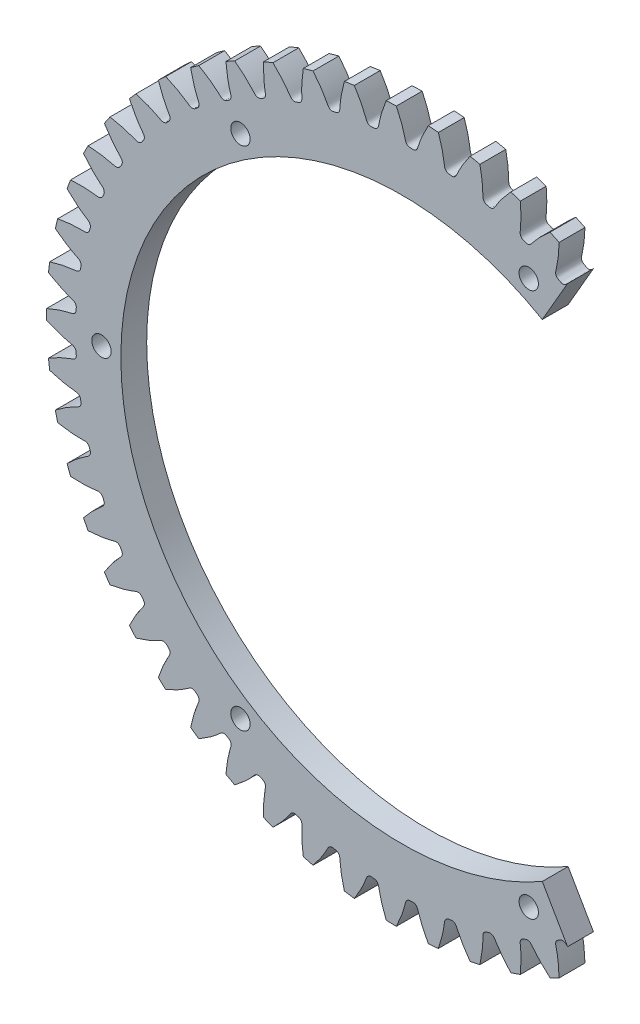
from build123d import *

# Parameters (mm, degrees)
SKETCH_339_W               = 4
SKETCH_339_H               = 54.999999174
CUT_EXTRUDE_594_DEPTH      = 2
PATTERN_CIRCULAR_646_COUNT = 53
CUT_EXTRUDE_START          = -10
SKETCH_1_R                 = 1.5
CUT_EXTRUDE_1_DEPTH        = 10


with BuildPart() as part:
    # Sketch 339 → Revolve 365 (revolve)
    with BuildSketch(Plane(origin=(0, 0, 0), x_dir=(0, 0, -1), z_dir=(1, 0, 0))):
        with Locations((0, 27.499999587)):
            Rectangle(SKETCH_339_W, SKETCH_339_H)
    revolve(axis=Axis((0, 0, 0), (0, 0, -1)))

    # Sketch 408 → Cut-Extrude 594 (cut, symmetric)
    with BuildSketch(Plane.XY):
        with BuildLine():
            ThreePointArc((55.041790784, 2.532030032), (55.099999172, 0), (55.041790784, -2.532030032))
            add(Edge.make_bspline(
                [(55.041790784, -2.532030032), (54.97592231, -2.497064374), (54.888177031, -2.451017899), (54.778505022, -2.394362073), (54.713498983, -2.361043168), (54.648840279, -2.32816281), (54.584531045, -2.295718436), (54.520573402, -2.263707474), (54.45696946, -2.232127342), (54.393721314, -2.200975452), (54.330831048, -2.170249202), (54.268300731, -2.139945986), (54.206132421, -2.110063185), (54.144328161, -2.080598175), (54.082889983, -2.05154832), (54.021819904, -2.022910978), (53.961119928, -1.994683496), (53.900792048, -1.966863213), (53.84083824, -1.939447462), (53.781260471, -1.912433564), (53.722060692, -1.885818832), (53.66324084, -1.859600574), (53.604802841, -1.833776086), (53.546748606, -1.808342658), (53.489080034, -1.78329757), (53.431799009, -1.758638096), (53.374907401, -1.7343615), (53.318407069, -1.710465038), (53.262299856, -1.686945961), (53.206587593, -1.663801508), (53.151272097, -1.641028913), (53.09635517, -1.618625402), (53.041838602, -1.596588191), (52.987724169, -1.574914491), (52.934013633, -1.553601504), (52.880708742, -1.532646426), (52.827811229, -1.512046443), (52.775322817, -1.491798735), (52.72324521, -1.471900476), (52.671580103, -1.45234883), (52.620329173, -1.433140956), (52.569494086, -1.414274004), (52.519076493, -1.395745118), (52.46907803, -1.377551435), (52.419500319, -1.359690085), (52.370344971, -1.342158191), (52.32161358, -1.324952868), (52.273307725, -1.308071226), (52.225428973, -1.291510366), (52.177978877, -1.275267385), (52.130958975, -1.259339373), (52.084370789, -1.24372341), (52.03821583, -1.228416573), (51.992495593, -1.213415933), (51.947211559, -1.198718551), (51.902365194, -1.184321485), (51.85795795, -1.170221786), (51.813991265, -1.156416497), (51.770466562, -1.142902657), (51.727385251, -1.129677298), (51.684748726, -1.116737446), (51.642558366, -1.104080122), (51.600815538, -1.09170234), (51.559521592, -1.079601107), (51.518677867, -1.06777343), (51.478285671, -1.056216293), (51.438346364, -1.044926734), (51.398861049, -1.033901567), (51.359831692, -1.023138403), (51.321257039, -1.012631908), (51.223739906, -0.98641783), (51.121213809, -0.959873857), (51.017889312, -0.91993613), (50.967425059, -0.898009557), (50.916533588, -0.872864773), (50.864684791, -0.843562747), (50.81136359, -0.808712157), (50.756198148, -0.766380659), (50.699263418, -0.713954921), (50.641643492, -0.648184536), (50.586225146, -0.565681156), (50.538568301, -0.46433517), (50.507112927, -0.349680202), (50.495024656, -0.192365207), (50.503280403, 0), (50.495024656, 0.192365207), (50.507112927, 0.349680202), (50.538568301, 0.46433517), (50.586225146, 0.565681156), (50.641643492, 0.648184536), (50.699263418, 0.713954921), (50.756198148, 0.766380659), (50.81136359, 0.808712157), (50.864684791, 0.843562747), (50.916533588, 0.872864773), (50.967425059, 0.898009557), (51.017889312, 0.91993613), (51.121213809, 0.959873857), (51.223739906, 0.98641783), (51.321257039, 1.012631908), (51.359831692, 1.023138403), (51.398861049, 1.033901567), (51.438346364, 1.044926734), (51.478285671, 1.056216293), (51.518677867, 1.06777343), (51.559521592, 1.079601107), (51.600815538, 1.09170234), (51.642558366, 1.104080122), (51.684748726, 1.116737446), (51.727385251, 1.129677298), (51.770466562, 1.142902657), (51.813991265, 1.156416497), (51.85795795, 1.170221786), (51.902365194, 1.184321485), (51.947211559, 1.198718551), (51.992495593, 1.213415933), (52.03821583, 1.228416573), (52.084370789, 1.24372341), (52.130958975, 1.259339373), (52.177978877, 1.275267385), (52.225428973, 1.291510366), (52.273307725, 1.308071226), (52.32161358, 1.324952868), (52.370344971, 1.342158191), (52.419500319, 1.359690085), (52.46907803, 1.377551435), (52.519076493, 1.395745118), (52.569494086, 1.414274004), (52.620329173, 1.433140956), (52.671580103, 1.45234883), (52.72324521, 1.471900476), (52.775322817, 1.491798735), (52.827811229, 1.512046443), (52.880708742, 1.532646426), (52.934013633, 1.553601504), (52.987724169, 1.574914491), (53.041838602, 1.596588191), (53.09635517, 1.618625402), (53.151272097, 1.641028913), (53.206587593, 1.663801508), (53.262299856, 1.686945961), (53.318407069, 1.710465038), (53.374907401, 1.7343615), (53.431799009, 1.758638096), (53.489080034, 1.78329757), (53.546748606, 1.808342658), (53.604802841, 1.833776086), (53.66324084, 1.859600574), (53.722060692, 1.885818832), (53.781260471, 1.912433564), (53.84083824, 1.939447462), (53.900792048, 1.966863213), (53.961119928, 1.994683496), (54.021819904, 2.022910978), (54.082889983, 2.05154832), (54.144328161, 2.080598175), (54.206132421, 2.110063185), (54.268300731, 2.139945986), (54.330831048, 2.170249202), (54.393721314, 2.200975452), (54.45696946, 2.232127342), (54.520573402, 2.263707474), (54.584531045, 2.295718436), (54.648840279, 2.32816281), (54.713498983, 2.361043168), (54.778505022, 2.394362073), (54.888177031, 2.451017899), (54.97592231, 2.497064374), (55.041790784, 2.532030032)],
                knots=[0, 0, 0, 0, 0.020369698, 0.027066958, 0.033717896, 0.040322512, 0.046880804, 0.053392775, 0.059858423, 0.066277748, 0.072650751, 0.078977432, 0.08525779, 0.091491825, 0.097679539, 0.103820929, 0.109915997, 0.115964743, 0.121967166, 0.127923267, 0.133833046, 0.139696502, 0.145513635, 0.151284446, 0.157008934, 0.1626871, 0.168318944, 0.173904465, 0.179443664, 0.18493654, 0.190383094, 0.195783325, 0.201137234, 0.20644482, 0.211706084, 0.216921025, 0.222089644, 0.22721194, 0.232287914, 0.237317566, 0.242300895, 0.247237902, 0.252128586, 0.256972947, 0.261770987, 0.266522703, 0.271228098, 0.275887169, 0.280499919, 0.285066346, 0.28958645, 0.294060232, 0.298487691, 0.302868828, 0.307203643, 0.311492135, 0.315734305, 0.319930152, 0.324079677, 0.328182879, 0.332239759, 0.336250316, 0.340214551, 0.344132463, 0.348004053, 0.35182932, 0.355608265, 0.359340888, 0.363027188, 0.366667165, 0.370260821, 0.390614253, 0.395520611, 0.400504667, 0.405639324, 0.411018509, 0.416762857, 0.423025001, 0.429991, 0.437869795, 0.446855887, 0.457048591, 0.468334789, 0.47911411, 0.5, 0.52088589, 0.531665211, 0.542951409, 0.553144113, 0.562130205, 0.570009, 0.576974999, 0.583237143, 0.588981491, 0.594360676, 0.599495333, 0.604479389, 0.609385747, 0.629739179, 0.633332835, 0.636972812, 0.640659112, 0.644391735, 0.64817068, 0.651995947, 0.655867537, 0.659785449, 0.663749684, 0.667760241, 0.671817121, 0.675920323, 0.680069848, 0.684265695, 0.688507865, 0.692796357, 0.697131172, 0.701512309, 0.705939768, 0.71041355, 0.714933654, 0.719500081, 0.724112831, 0.728771902, 0.733477297, 0.738229013, 0.743027053, 0.747871414, 0.752762098, 0.757699105, 0.762682434, 0.767712086, 0.77278806, 0.777910356, 0.783078975, 0.788293916, 0.79355518, 0.798862766, 0.804216675, 0.809616906, 0.81506346, 0.820556336, 0.826095535, 0.831681056, 0.8373129, 0.842991066, 0.848715554, 0.854486365, 0.860303498, 0.866166954, 0.872076733, 0.878032834, 0.884035257, 0.890084003, 0.896179071, 0.902320461, 0.908508175, 0.91474221, 0.921022568, 0.927349249, 0.933722252, 0.940141577, 0.946607225, 0.953119196, 0.959677488, 0.966282104, 0.972933042, 0.979630302, 1, 1, 1, 1], degree=3))
        make_face()
    cut_extrude_594 = extrude(amount=CUT_EXTRUDE_594_DEPTH, both=True, mode=Mode.SUBTRACT)

    # Pattern Circular 646: Cut-Extrude 594 ×53 about axis
    pattern_circular_646_axis = Axis((0, 0, 55), (0, 0, -1))
    for i in range(1, PATTERN_CIRCULAR_646_COUNT):
        add(cut_extrude_594.rotate(pattern_circular_646_axis, i * 360 / PATTERN_CIRCULAR_646_COUNT), mode=Mode.SUBTRACT)

    # 草图1 → 切除-拉伸1 (cut)
    with BuildSketch(Plane.XY.offset(2).offset(CUT_EXTRUDE_START)):
        with Locations((-46.5, 0)):
            Circle(SKETCH_1_R)
        with Locations((19.651749171, 42.143312097)):
            Circle(SKETCH_1_R)
        with Locations((-24.984431788, 39.21770223)):
            Circle(SKETCH_1_R)
        with Locations((19.651749171, -42.143312097)):
            Circle(SKETCH_1_R)
        with Locations((-24.984431788, -39.21770223)):
            Circle(SKETCH_1_R)
        with BuildLine():
            Line((21.75, 37.672105065), (27.499999587, 47.631396493))
            ThreePointArc((27.499999587, 47.631396493), (54.999999174, 0), (27.499999587, -47.631396493))
            Line((27.499999587, -47.631396493), (21.75, -37.672105065))
            ThreePointArc((21.75, -37.672105065), (-43.5, 0), (21.75, 37.672105065))
        make_face()
    extrude(amount=CUT_EXTRUDE_1_DEPTH, mode=Mode.SUBTRACT)


solid = part.part
